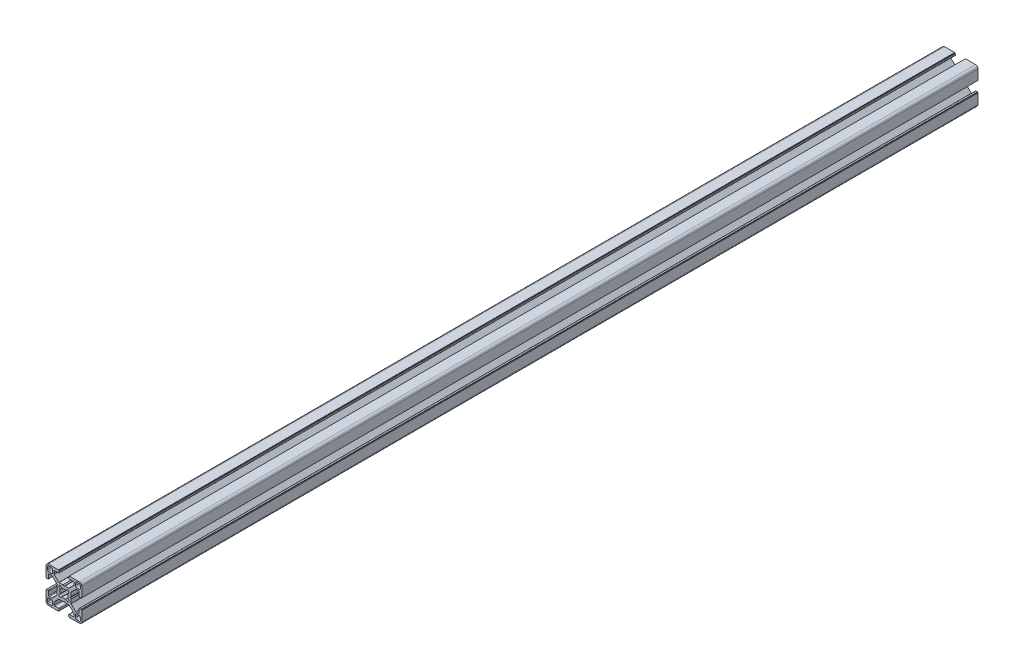
from build123d import *

# Parameters (mm, degrees)
BOSS_EXTRUDE1_DEPTH = 375
CIRPATTERN1_COUNT   = 4


with BuildPart() as part:
    # Sketch3 → Boss-Extrude1 (new, symmetric)
    with BuildSketch(Plane.XY):
        with BuildLine():
            Line((-4.503841895, 3.156803476), (-3.14772708, 1.530298739))
            ThreePointArc((-3.14772708, 1.530298739), (-3.410794979, 0.785160882), (-3.5, 0))
            Line((-3.5, 0), (-5.5, 0))
            Line((-5.5, 0), (-6, 0.866025404))
            Line((-6, 0.866025404), (-6, 3.996841995))
            ThreePointArc((-6, 3.996841995), (-6.038060234, 4.188183711), (-6.146446609, 4.350395385))
            Line((-6.146446609, 4.350395385), (-9.917104615, 8.121053391))
            ThreePointArc((-9.917104615, 8.121053391), (-10.079316289, 8.229439766), (-10.270658005, 8.2675))
            Line((-10.270658005, 8.2675), (-12.29, 8.2675))
            ThreePointArc((-12.29, 8.2675), (-12.643553391, 8.121053391), (-12.79, 7.7675))
            Line((-12.79, 7.7675), (-12.79, 4.5))
            ThreePointArc((-12.79, 4.5), (-12.936446609, 4.146446609), (-13.29, 4))
            Line((-13.29, 4), (-14.5, 4))
            Line((-14.5, 4), (-14.5, 4.5))
            Line((-14.5, 4.5), (-15, 4.5))
            Line((-15, 4.5), (-15, 12.968))
            ThreePointArc((-15, 12.968), (-14.404840979, 14.404840979), (-12.968, 15))
            Line((-12.968, 15), (-4.5, 15))
            Line((-4.5, 15), (-4.5, 14.5))
            Line((-4.5, 14.5), (-4, 14.5))
            Line((-4, 14.5), (-4, 13.29))
            ThreePointArc((-4, 13.29), (-4.146446609, 12.936446609), (-4.5, 12.79))
            Line((-4.5, 12.79), (-7.7675, 12.79))
            ThreePointArc((-7.7675, 12.79), (-8.121053391, 12.643553391), (-8.2675, 12.29))
            Line((-8.2675, 12.29), (-8.2675, 10.270658005))
            ThreePointArc((-8.2675, 10.270658005), (-8.229439766, 10.079316289), (-8.121053391, 9.917104615))
            Line((-8.121053391, 9.917104615), (-4.350395385, 6.146446609))
            ThreePointArc((-4.350395385, 6.146446609), (-4.188183711, 6.038060234), (-3.996841995, 6))
            Line((-3.996841995, 6), (-0.866025404, 6))
            Line((-0.866025404, 6), (0, 5.5))
            Line((0, 5.5), (0, 3.5))
            ThreePointArc((0, 3.5), (-0.785160882, 3.410794979), (-1.530298739, 3.14772708))
            Line((-1.530298739, 3.14772708), (-3.156803476, 4.503841895))
            ThreePointArc((-3.156803476, 4.503841895), (-3.889087297, 3.889087297), (-4.503841895, 3.156803476))
        make_face()
        with BuildLine():
            Line((-12.705, 9.5135), (-10.5135, 9.5135))
            ThreePointArc((-10.5135, 9.5135), (-9.806393219, 9.806393219), (-9.5135, 10.5135))
            Line((-9.5135, 10.5135), (-9.5135, 12.705))
            ThreePointArc((-9.5135, 12.705), (-9.806393219, 13.412106781), (-10.5135, 13.705))
            Line((-10.5135, 13.705), (-12.705, 13.705))
            ThreePointArc((-12.705, 13.705), (-13.412106781, 13.412106781), (-13.705, 12.705))
            Line((-13.705, 12.705), (-13.705, 10.5135))
            ThreePointArc((-13.705, 10.5135), (-13.412106781, 9.806393219), (-12.705, 9.5135))
        make_face(mode=Mode.SUBTRACT)
    boss_extrude1 = extrude(amount=BOSS_EXTRUDE1_DEPTH, both=True)

    # CirPattern1: Boss-Extrude1 ×4 about axis
    cirpattern1_axis = Axis((0, 0, 76.2), (0, 0, -1))
    for i in range(1, CIRPATTERN1_COUNT):
        add(boss_extrude1.rotate(cirpattern1_axis, i * 360 / CIRPATTERN1_COUNT))


solid = part.part
